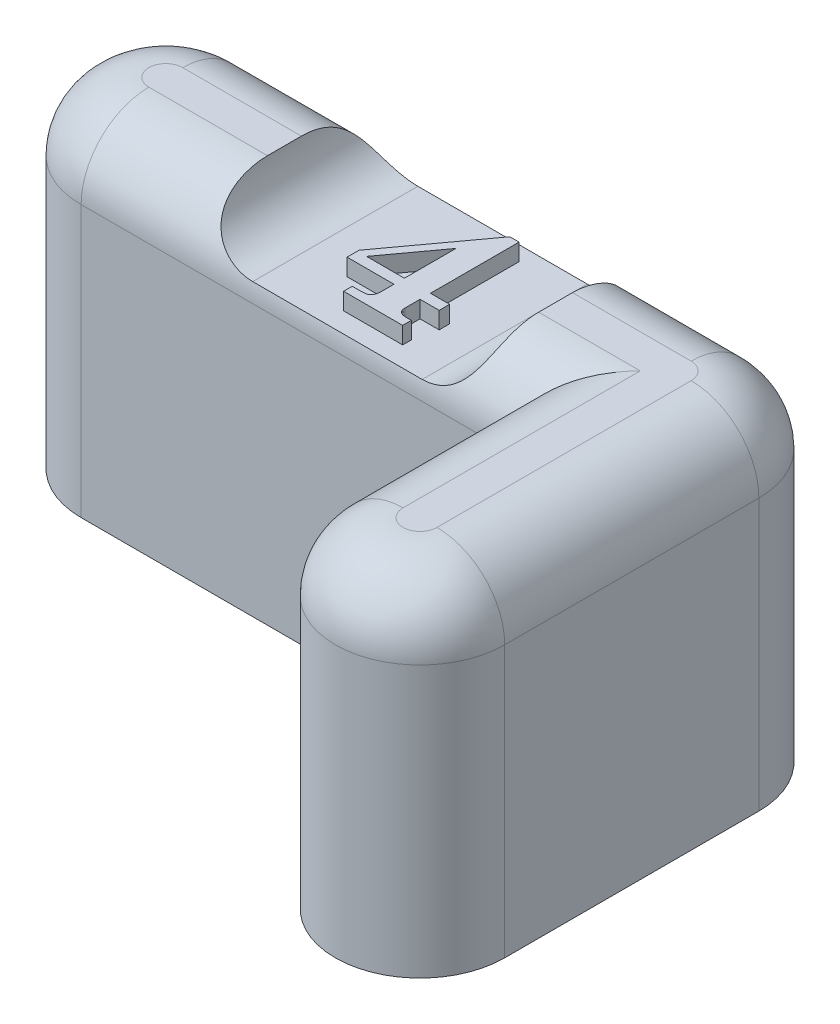
from build123d import *

# Parameters (mm, degrees)
BOSS_EXTRUDE1_DEPTH     = 20
FILLET1_R               = 4
SKETCH2_R               = 2.75
CUT_EXTRUDE1_DEPTH      = 1.5
LPATTERN1_COUNT         = 2
LPATTERN1_PITCH         = 30
CUT_EXTRUDE2_DEPTH      = 35.641016151
CUT_EXTRUDE2_DEPTH_BACK = 35.641016151
WRAP1_DEPTH             = 1


# Read off the part's stored shape, not the designer's step: Wrap1
with BuildPart() as part:
    # Sketch1 → Boss-Extrude1 (new body)
    with BuildSketch(Plane(origin=(0, 0, 0), x_dir=(1, 0, 0), z_dir=(0, 1, 0))):
        with BuildLine():
            Line((-15, -5), (10, -5))
            Line((10, -5), (10, -15))
            ThreePointArc((10, -15), (15, -20), (20, -15))
            Line((20, -15), (20, 0))
            ThreePointArc((20, 0), (18.535533906, 3.535533906), (15, 5))
            Line((15, 5), (-15, 5))
            ThreePointArc((-15, 5), (-20, 0), (-15, -5))
        make_face()
    extrude(amount=BOSS_EXTRUDE1_DEPTH)

    # Fillet1
    fillet1_edges = [part.edges().sort_by_distance(p)[0] for p in [
        (15, 20, 20),
        (20, 20, 7.5),
        (18.535533906, 20, -3.535533906),
        (0, 20, -5),
        (-20, 20, 0),
        (-2.5, 20, 5),
        (10, 20, 10),
    ]]
    fillet(fillet1_edges, radius=FILLET1_R)

    # Sketch2 → Cut-Extrude1 (cut)
    with BuildSketch(Plane.XZ):
        with Locations(Location((-15, 0, 0), (0, 0, 270))):
            Circle(SKETCH2_R)
    cut_extrude1 = extrude(amount=-CUT_EXTRUDE1_DEPTH, mode=Mode.SUBTRACT)

    # LPattern1: Cut-Extrude1 ×2
    with Locations(*[(i * LPATTERN1_PITCH, 0, 0) for i in range(1, LPATTERN1_COUNT)]):
        add(cut_extrude1, mode=Mode.SUBTRACT)

    # Sketch3 → Cut-Extrude2 (cut, two sides: drawn at the far end of the back side and taken through both)
    with BuildSketch(Plane.XY.offset(-CUT_EXTRUDE2_DEPTH_BACK)):
        with BuildLine():
            Line((5, 17), (-5, 17))
            ThreePointArc((-5, 17), (-8, 20), (-5, 23))
            Line((-5, 23), (5, 23))
            ThreePointArc((5, 23), (8, 20), (5, 17))
        make_face()
    extrude(amount=CUT_EXTRUDE2_DEPTH + CUT_EXTRUDE2_DEPTH_BACK, mode=Mode.SUBTRACT)

    # Wrap1 outline → Wrap1 (add)
    with BuildSketch(Plane(origin=(0, 17, 0), x_dir=(1, 0, 0), z_dir=(0, 1, 0))):
        with BuildLine():
            add(Edge.make_bspline(
                [(1.841863893, -2.738252863), (1.843167117, -2.772610038), (1.845627679, -2.837478309), (1.870220056, -2.928234816), (1.910417773, -3.005660397), (1.968656697, -3.069246584), (2.04558102, -3.11604167), (2.138808991, -3.149069173), (2.249599225, -3.170094309), (2.329470455, -3.171691186), (2.372312611, -3.172547735)],
                knots=[0, 0, 0, 0, 0.130861591, 0.247074017, 0.355594274, 0.460908048, 0.571758266, 0.695587752, 0.836716212, 1, 1, 1, 1], degree=3))
            Line((1.841863893, -2.738252863), (1.841863893, -1.839214402))
            Line((1.841863893, -1.839214402), (2.970069021, -1.839214402))
            Line((2.970069021, -1.839214402), (2.970069021, -1.223829786))
            Line((2.970069021, -1.223829786), (1.841863893, -1.223829786))
            Line((1.841863893, -1.223829786), (1.841863893, 4.006939444))
            Line((1.841863893, 4.006939444), (1.295389534, 4.006939444))
            Line((1.295389534, 4.006939444), (-2.465828415, -1.130881068))
            Line((-2.465828415, -1.130881068), (-2.465828415, -1.839214402))
            Line((-2.465828415, -1.839214402), (0.303402354, -1.839214402))
            Line((0.303402354, -1.839214402), (0.303402354, -2.579599017))
            add(Edge.make_bspline(
                [(0.154363893, -3.050752863), (0.177887379, -3.022926473), (0.227059219, -2.964760144), (0.27088721, -2.852439848), (0.29873926, -2.722573798), (0.301775942, -2.629466316), (0.303402354, -2.579599017)],
                knots=[0, 0, 0, 0, 0.214745145, 0.448888149, 0.704830817, 1, 1, 1, 1], degree=3))
            add(Edge.make_bspline(
                [(-0.279930979, -3.172547735), (-0.230645452, -3.171172689), (-0.140021776, -3.168644324), (-0.016795191, -3.146993527), (0.083806957, -3.111501143), (0.132261074, -3.069783001), (0.154363893, -3.050752863)],
                knots=[0, 0, 0, 0, 0.31964973, 0.587755386, 0.811950592, 1, 1, 1, 1], degree=3))
            Line((-0.279930979, -3.172547735), (-0.824802774, -3.172547735))
            Line((-0.824802774, -3.172547735), (-0.824802774, -3.685368248))
            Line((-0.824802774, -3.685368248), (2.662376713, -3.685368248))
            Line((2.662376713, -3.685368248), (2.662376713, -3.172547735))
            Line((2.662376713, -3.172547735), (2.372312611, -3.172547735))
        make_face()
        Polygon((0.303402354, 1.822644573), (0.303402354, -1.223829786), (-1.927366876, -1.223829786), align=None, mode=Mode.SUBTRACT)
    extrude(amount=WRAP1_DEPTH)


solid = part.part
